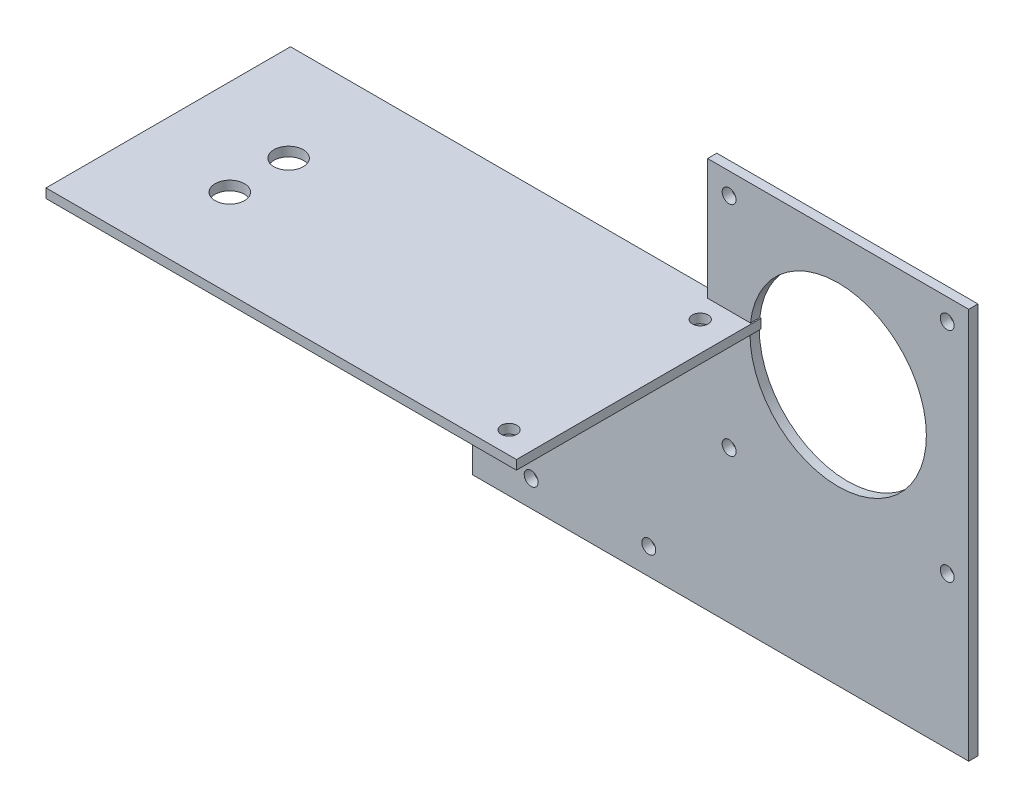
from build123d import *

# Parameters (mm, degrees)
SKETCH1_R           = 1.5
SKETCH1_R_2         = 19.05
BOSS_EXTRUDE1_DEPTH = 2
BOSS_EXTRUDE2_DEPTH = 52.8
SKETCH3_R           = 1.7
CUT_EXTRUDE1_DEPTH  = 133.22344724
SKETCH4_R           = 3.175
CUT_EXTRUDE2_DEPTH  = 10


with BuildPart() as part:
    # Sketch1 → Boss-Extrude1 (new body)
    with BuildSketch(Plane.XY):
        Polygon((0, 58.4), (0, 0), (107.2, 0), (107.2, 84.53204182), (50.8, 84.53204182), (50.8, 58.4), align=None)
        with Locations((102.55, 79.88204182)):
            Circle(SKETCH1_R, mode=Mode.SUBTRACT)
        with Locations((102.55, 32.78204182)):
            Circle(SKETCH1_R, mode=Mode.SUBTRACT)
        with Locations((55.45, 32.78204182)):
            Circle(SKETCH1_R, mode=Mode.SUBTRACT)
        with Locations((55.45, 79.88204182)):
            Circle(SKETCH1_R, mode=Mode.SUBTRACT)
        with Locations((12.7, 52.75)):
            Circle(SKETCH1_R, mode=Mode.SUBTRACT)
        with Locations((38.1, 52.75)):
            Circle(SKETCH1_R, mode=Mode.SUBTRACT)
        with Locations((12.7, 5.65)):
            Circle(SKETCH1_R, mode=Mode.SUBTRACT)
        with Locations((38.1, 5.65)):
            Circle(SKETCH1_R, mode=Mode.SUBTRACT)
        with Locations((79, 56.33204182)):
            Circle(SKETCH1_R_2, mode=Mode.SUBTRACT)
    extrude(amount=-BOSS_EXTRUDE1_DEPTH)

    # Sketch2 → Boss-Extrude2 (add)
    with BuildSketch(Plane(origin=(0, 0, -2), x_dir=(-1, 0, 0), z_dir=(0, 0, -1))):
        Polygon((0, 58.4), (41.275, 58.4), (41.275, 56.4), (0, 56.4), (-60.325, 56.4), (-60.325, 58.4), align=None)
    extrude(amount=-BOSS_EXTRUDE2_DEPTH)

    # Sketch3 → Cut-Extrude1 (cut, through all)
    with BuildSketch(Plane(origin=(0, 58.4, 0), x_dir=(1, 0, 0), z_dir=(0, 1, 0))):
        with Locations((53.975, -4.7625)):
            Circle(SKETCH3_R)
        with Locations((53.975, -46.0375)):
            Circle(SKETCH3_R)
    extrude(amount=-CUT_EXTRUDE1_DEPTH, mode=Mode.SUBTRACT)

    # Sketch4 → Cut-Extrude2 (cut)
    with BuildSketch(Plane(origin=(0, 58.4, 0), x_dir=(1, 0, 0), z_dir=(0, 1, 0))):
        with Locations((-20.6375, -19.05)):
            Circle(SKETCH4_R)
        with Locations((-20.6375, -31.75)):
            Circle(SKETCH4_R)
    extrude(amount=-CUT_EXTRUDE2_DEPTH, mode=Mode.SUBTRACT)


solid = part.part
